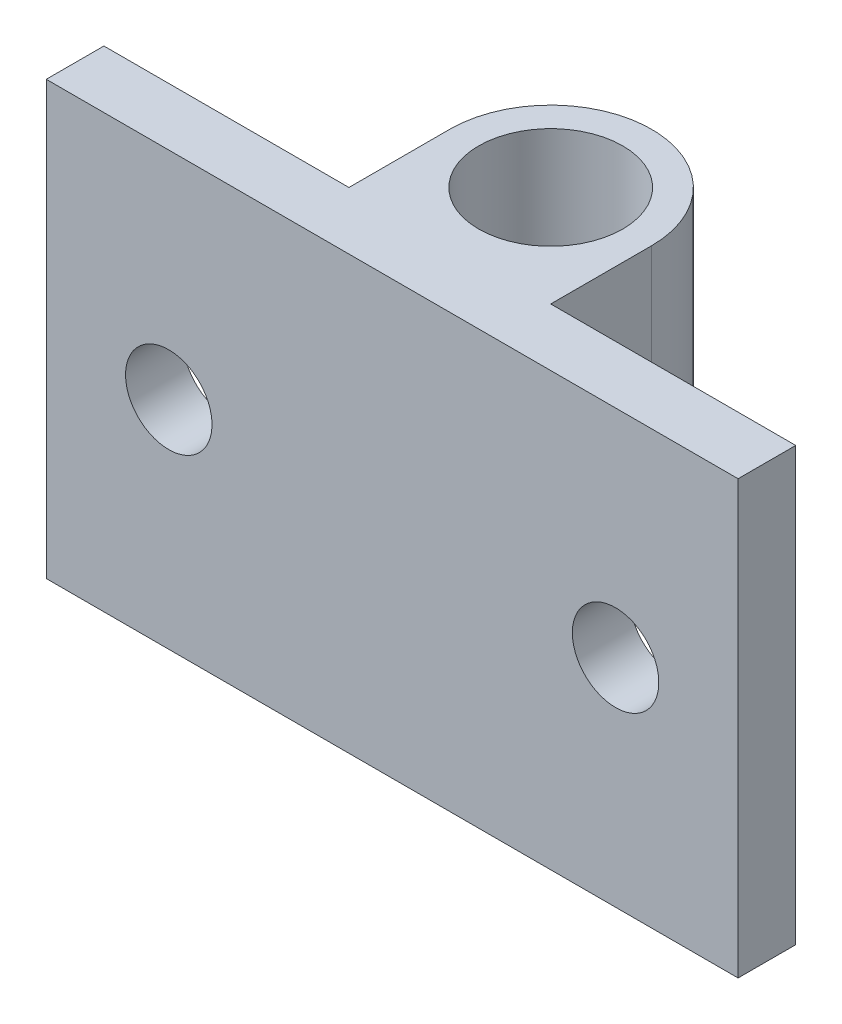
from build123d import *

# Parameters (mm, degrees)
SKETCH1_R           = 2.5
BOSS_EXTRUDE1_DEPTH = 15
SKETCH2_R           = 1.5
CUT_EXTRUDE1_DEPTH  = 21.4450483
SKETCH3_W           = 7
SKETCH3_H           = 7.5
CUT_EXTRUDE2_DEPTH  = 21.4450483


with BuildPart() as part:
    # Sketch1 → Boss-Extrude1 (new body)
    with BuildSketch(Plane(origin=(0, 0, 0), x_dir=(1, 0, 0), z_dir=(0, 1, 0))):
        with BuildLine():
            Line((3.5, -3.5), (3.5, 0))
            ThreePointArc((3.5, 0), (0, 3.5), (-3.5, 0))
            Line((-3.5, 0), (-3.5, -3.5))
            Line((-3.5, -3.5), (-12, -3.5))
            Line((-12, -3.5), (-12, -5.5))
            Line((-12, -5.5), (12, -5.5))
            Line((12, -5.5), (12, -3.5))
            Line((12, -3.5), (3.5, -3.5))
        make_face()
        Circle(SKETCH1_R, mode=Mode.SUBTRACT)
    extrude(amount=BOSS_EXTRUDE1_DEPTH)

    # Sketch2 → Cut-Extrude1 (cut, through all)
    with BuildSketch(Plane(origin=(0, 0, 3.5), x_dir=(-1, 0, 0), z_dir=(0, 0, -1))):
        with Locations((7.75, 7.5)):
            Circle(SKETCH2_R)
        with Locations((-7.75, 7.5)):
            Circle(SKETCH2_R)
    extrude(amount=-CUT_EXTRUDE1_DEPTH, mode=Mode.SUBTRACT)

    # Sketch3 → Cut-Extrude2 (cut, through all)
    with BuildSketch(Plane(origin=(0, 0, 3.5), x_dir=(-1, 0, 0), z_dir=(0, 0, -1))):
        with Locations((0, 3.75)):
            Rectangle(SKETCH3_W, SKETCH3_H)
    extrude(amount=CUT_EXTRUDE2_DEPTH, mode=Mode.SUBTRACT)


solid = part.part
